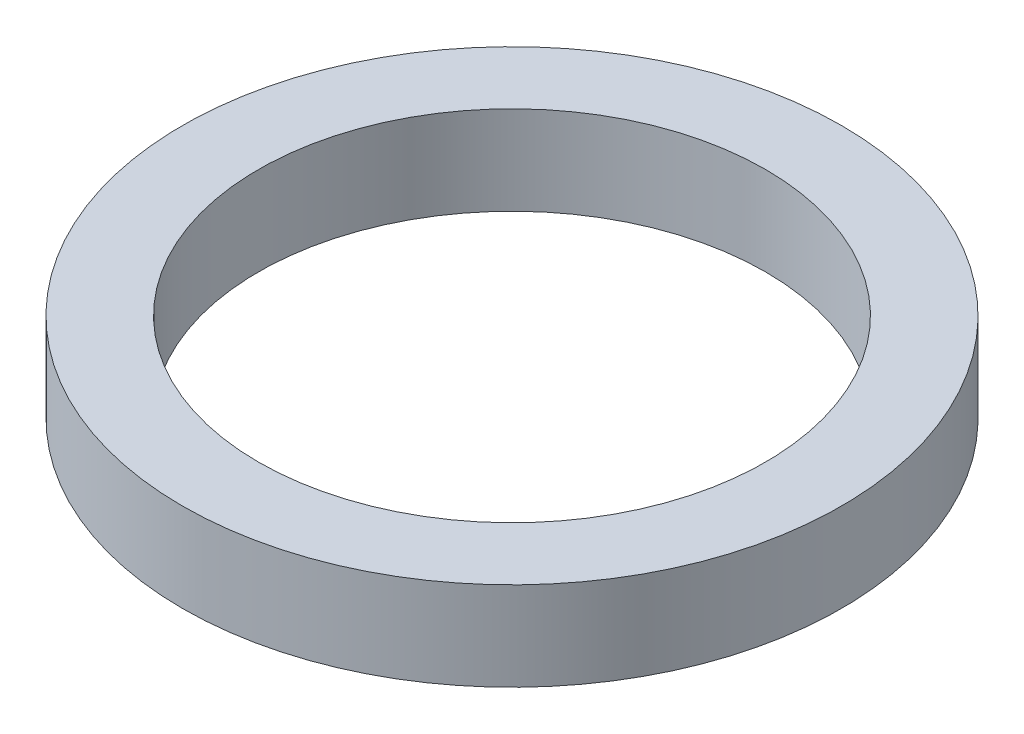
from build123d import *

# Parameters (mm, degrees)
SKETCH2_R           = 26
SKETCH2_R_2         = 20
BOSS_EXTRUDE1_DEPTH = 3.5


with BuildPart() as part:
    # Sketch2 → Boss-Extrude1 (new, symmetric)
    with BuildSketch(Plane(origin=(0, 0, 0), x_dir=(1, 0, 0), z_dir=(0, 1, 0))):
        Circle(SKETCH2_R)
        Circle(SKETCH2_R_2, mode=Mode.SUBTRACT)
    extrude(amount=BOSS_EXTRUDE1_DEPTH, both=True)


solid = part.part
